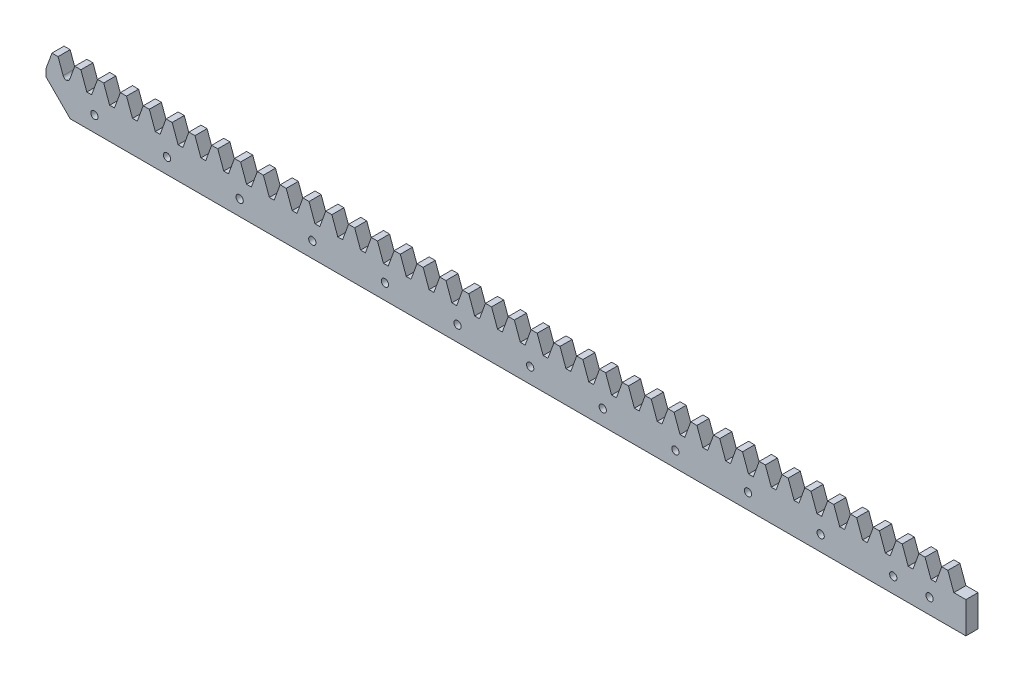
from build123d import *

# Parameters (mm, degrees)
SKETCH_1_W             = 380
SKETCH_1_H             = 10
EXTRUDE_1_DEPTH        = 5
EXTRUDE_2_DEPTH        = 5
PATTERN_LINEAR_1_COUNT = 40
PATTERN_LINEAR_1_PITCH = 9.424777961
FILLET_1_R             = 1.5
SKETCH_4_W             = 380
SKETCH_4_H             = 5
EXTRUDE_1_2_DEPTH      = 3
CHAMFER_1_SIZE         = 10
SKETCH_5_R             = 1.5
CUT_EXTRUDE_2_DEPTH    = 381.25517748


with BuildPart() as part:
    # 草图1 → Extrude 1 (new body)
    with BuildSketch(Plane.XY):
        with Locations((190, -5)):
            Rectangle(SKETCH_1_W, SKETCH_1_H)
    extrude(amount=EXTRUDE_1_DEPTH)

    # 草图2 → 拉伸2 (add)
    with BuildSketch(Plane.XY.offset(5)):
        Polygon((0, 0), (2.456799081, 6.75), (4.985366656, 6.75), (7.442165737, 0), align=None)
    extrude_2 = extrude(amount=-EXTRUDE_2_DEPTH)

    # 阵列(线性)1: 拉伸2 ×40
    with Locations(*[(i * PATTERN_LINEAR_1_PITCH, 0, 0) for i in range(1, PATTERN_LINEAR_1_COUNT)]):
        add(extrude_2)

    # 圆角1
    # the kernel refuses this fillet: 1.5 mm, written as the material it adds along each edge
    with BuildSketch(Plane(origin=(9.424777961, 0, 5), x_dir=(-1, 0, 0), z_dir=(0, 0, -1))) as fillet_1_piece_1:
        with BuildLine():
            CenterArc((FILLET_1_R * 0.70020753821, FILLET_1_R), FILLET_1_R, 200, 70)
            Line((-FILLET_1_R * 0.239485082576, FILLET_1_R * 0.657979856674), (0, 0))
            Line((0, 0), (FILLET_1_R * 0.70020753821, 0))
        make_face()
    extrude(amount=5)
    with BuildSketch(Plane(origin=(7.442165737, 0, 5), x_dir=(1, 0, 0), z_dir=(0, 0, -1))) as fillet_1_piece_2:
        with BuildLine():
            CenterArc((FILLET_1_R * 0.70020753821, -FILLET_1_R), FILLET_1_R, 90, 70)
            Line((-FILLET_1_R * 0.239485082576, -FILLET_1_R * 0.657979856674), (0, 0))
            Line((0, 0), (FILLET_1_R * 0.70020753821, 0))
        make_face()
    extrude(amount=5)

    # 草图4 → Extrude 1 2 (add)
    with BuildSketch(Plane.XZ.offset(10)):
        with Locations((190, 2.5)):
            Rectangle(SKETCH_4_W, SKETCH_4_H)
    extrude(amount=EXTRUDE_1_2_DEPTH)

    # 倒角1
    chamfer_1_edges = [part.edges().sort_by_distance(p)[0] for p in [
        (0, -13, 2.5),
    ]]
    chamfer(chamfer_1_edges, length=CHAMFER_1_SIZE)

    # 草图5 → 切除-拉伸2 (cut, through all)
    with BuildSketch(Plane.XY.offset(5)):
        with Locations((365, -6.65)):
            Circle(SKETCH_5_R)
        with Locations((350, -6.65)):
            Circle(SKETCH_5_R)
        with Locations((320, -6.65)):
            Circle(SKETCH_5_R)
        with Locations((290, -6.65)):
            Circle(SKETCH_5_R)
        with Locations((260, -6.65)):
            Circle(SKETCH_5_R)
        with Locations((230, -6.65)):
            Circle(SKETCH_5_R)
        with Locations((200, -6.65)):
            Circle(SKETCH_5_R)
        with Locations((170, -6.65)):
            Circle(SKETCH_5_R)
        with Locations((140, -6.65)):
            Circle(SKETCH_5_R)
        with Locations((110, -6.65)):
            Circle(SKETCH_5_R)
        with Locations((80, -6.65)):
            Circle(SKETCH_5_R)
        with Locations((50, -6.65)):
            Circle(SKETCH_5_R)
        with Locations((20, -6.65)):
            Circle(SKETCH_5_R)
    extrude(amount=-CUT_EXTRUDE_2_DEPTH, mode=Mode.SUBTRACT)


solid = part.part
